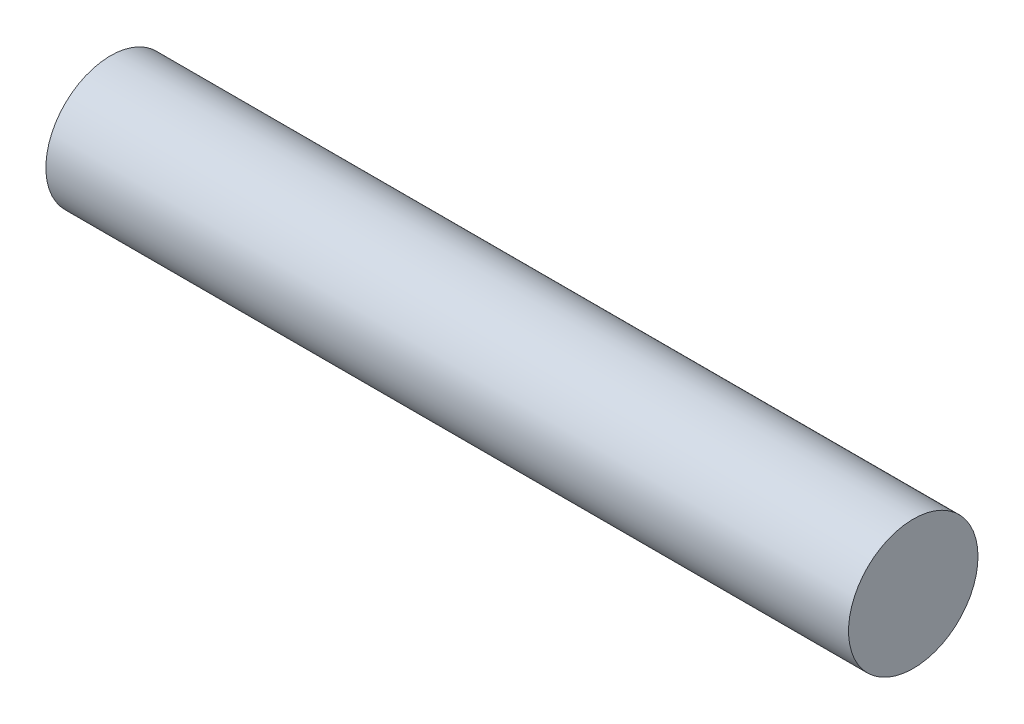
from build123d import *

# Parameters (mm, degrees)
SKETCH1_R           = 0.9525
BOSS_EXTRUDE1_DEPTH = 5.9055


with BuildPart() as part:
    # Sketch1 → Boss-Extrude1 (new, symmetric)
    with BuildSketch(Plane(origin=(0, 0, 0), x_dir=(0, 0, -1), z_dir=(1, 0, 0))):
        Circle(SKETCH1_R)
    extrude(amount=BOSS_EXTRUDE1_DEPTH, both=True)


solid = part.part
